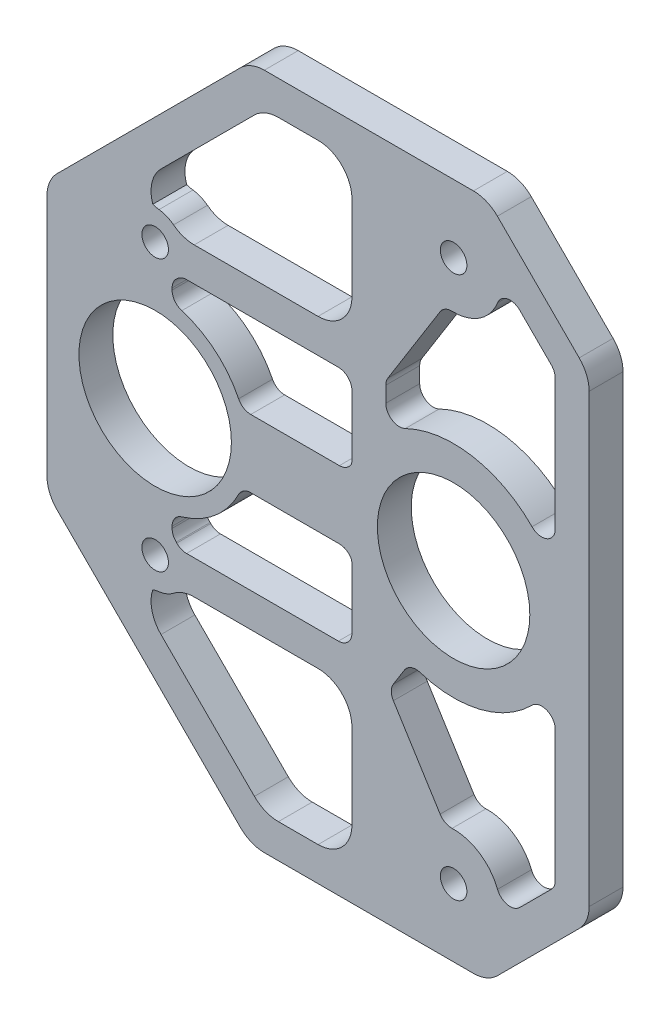
from build123d import *

# Parameters (mm, degrees)
SKETCH1_W           = 101.6
SKETCH1_H           = 127
SKETCH1_R           = 2.4892
SKETCH1_R_2         = 14.2875
BOSS_EXTRUDE1_DEPTH = 3.175
CHAMFER2_SIZE       = 38.1
CHAMFER3_SIZE       = 19.05
FILLET2_R           = 6.35
CUT_EXTRUDE2_DEPTH  = 163.763271348
FILLET11_R          = 2.54
FILLET12_R          = 6.35


with BuildPart() as part:
    # Sketch1 → Boss-Extrude1 (new, symmetric)
    with BuildSketch(Plane.XY):
        with Locations((50.8, 63.5)):
            Rectangle(SKETCH1_W, SKETCH1_H)
        with Locations((20.2692, 88.9)):
            Circle(SKETCH1_R, mode=Mode.SUBTRACT)
        with Locations((20.2692, 63.5)):
            Circle(SKETCH1_R_2, mode=Mode.SUBTRACT)
        with Locations((20.2692, 38.1)):
            Circle(SKETCH1_R, mode=Mode.SUBTRACT)
        with Locations((76.2, 114.3)):
            Circle(SKETCH1_R, mode=Mode.SUBTRACT)
        with Locations((76.2, 63.5)):
            Circle(SKETCH1_R_2, mode=Mode.SUBTRACT)
        with Locations((76.2, 12.7)):
            Circle(SKETCH1_R, mode=Mode.SUBTRACT)
    extrude(amount=BOSS_EXTRUDE1_DEPTH, both=True)

    # Chamfer2
    chamfer2_edges = [part.edges().sort_by_distance(p)[0] for p in [
        (0, 127, 0),
        (0, 0, 0),
    ]]
    chamfer(chamfer2_edges, length=CHAMFER2_SIZE)

    # Chamfer3
    chamfer3_edges = [part.edges().sort_by_distance(p)[0] for p in [
        (101.6, 127, 0),
        (101.6, 0, 0),
    ]]
    chamfer(chamfer3_edges, length=CHAMFER3_SIZE)

    # Fillet2
    fillet2_edges = [part.edges().sort_by_distance(p)[0] for p in [
        (38.1, 0, 0),
        (0, 88.9, 0),
        (0, 38.1, 0),
        (38.1, 127, 0),
        (101.6, 107.95, 0),
        (101.6, 19.05, 0),
        (82.55, 0, 0),
        (82.55, 127, 0),
    ]]
    fillet(fillet2_edges, radius=FILLET2_R)

    # Sketch2 → Cut-Extrude2 (cut, through all)
    with BuildSketch(Plane.XY.offset(3.175)):
        with BuildLine():
            Line((23.4442, 84.209313841), (23.4442, 80.671437949))
            ThreePointArc((23.4442, 80.671437949), (31.394578854, 76.959749314), (36.536234341, 69.85))
            Line((36.536234341, 69.85), (56.563709458, 69.85))
            ThreePointArc((56.563709458, 69.85), (56.840575731, 70.649762109), (57.15, 71.4375))
            Line((57.15, 71.4375), (57.15, 85.725))
            Line((57.15, 85.725), (24.959886159, 85.725))
            ThreePointArc((24.959886159, 85.725), (24.27439423, 84.89480577), (23.4442, 84.209313841))
        make_face()
        with BuildLine():
            Line((56.563709458, 57.15), (36.536234341, 57.15))
            ThreePointArc((36.536234341, 57.15), (31.394578854, 50.040250686), (23.4442, 46.328562051))
            Line((23.4442, 46.328562051), (23.4442, 42.790686159))
            ThreePointArc((23.4442, 42.790686159), (24.27439423, 42.10519423), (24.959886159, 41.275))
            Line((24.959886159, 41.275), (57.15, 41.275))
            Line((57.15, 41.275), (57.15, 55.5625))
            ThreePointArc((57.15, 55.5625), (56.840575731, 56.350237891), (56.563709458, 57.15))
        make_face()
        with BuildLine():
            Line((63.5, 87.989421981), (63.5, 79.767034341))
            ThreePointArc((63.5, 79.767034341), (81.436975328, 83.461976246), (95.25, 71.4375))
            Line((95.25, 71.4375), (95.25, 105.319743879))
            Line((95.25, 105.319743879), (84.938355823, 115.631388056))
            ThreePointArc((84.938355823, 115.631388056), (82.324026952, 107.926009842), (74.520278177, 105.621867065))
            Line((74.520278177, 105.621867065), (63.5, 87.989421981))
        make_face()
        with BuildLine():
            Line((16.869792091, 96.78953597), (19.197448039, 94.461880022))
            ThreePointArc((19.197448039, 94.461880022), (22.436795498, 94.133038448), (24.959886159, 92.075))
            Line((24.959886159, 92.075), (57.15, 92.075))
            Line((57.15, 92.075), (57.15, 120.65))
            Line((57.15, 120.65), (40.730256121, 120.65))
            Line((40.730256121, 120.65), (16.869792091, 96.78953597))
        make_face()
        with BuildLine():
            Line((57.15, 6.35), (57.15, 34.925))
            Line((57.15, 34.925), (24.959886159, 34.925))
            ThreePointArc((24.959886159, 34.925), (22.436795498, 32.866961552), (19.197448039, 32.538119978))
            Line((19.197448039, 32.538119978), (16.869792091, 30.21046403))
            Line((16.869792091, 30.21046403), (40.730256121, 6.35))
            Line((40.730256121, 6.35), (57.15, 6.35))
        make_face()
        with BuildLine():
            ThreePointArc((95.25, 55.5625), (83.968438742, 44.380435001), (68.08475867, 44.525035852))
            Line((68.08475867, 44.525035852), (64.069111262, 38.1))
            Line((64.069111262, 38.1), (74.520278177, 21.378132935))
            ThreePointArc((74.520278177, 21.378132935), (82.324026952, 19.073990158), (84.938355823, 11.368611944))
            Line((84.938355823, 11.368611944), (95.25, 21.680256121))
            Line((95.25, 21.680256121), (95.25, 55.5625))
        make_face()
    extrude(amount=-CUT_EXTRUDE2_DEPTH, mode=Mode.SUBTRACT)

    # Fillet11
    # the kernel refuses this fillet: 2.54 mm, written as the material it adds along each edge
    with BuildSketch(Plane(origin=(23.4442, 84.209313841, 3.175), x_dir=(0, -1, 0), z_dir=(0, 0, -1))) as fillet11_piece_1:
        with BuildLine():
            CenterArc((1.19554121, -2.54), FILLET11_R, 90, 45.845590986)
            ThreePointArc((-0.626820204, -0.770650155), (-0.296483035, -0.399092969), (0, 0))
            Line((0, 0), (1.19554121, 0))
        make_face()
    extrude(amount=6.35)
    with BuildSketch(Plane(origin=(24.959886159, 85.725, 3.175), x_dir=(1, 0, 0), z_dir=(0, 0, -1)), Plane(origin=(23.4442, 42.790686159, 3.175), x_dir=(0, 1, 0), z_dir=(0, 0, -1))) as fillet11_piece_2:
        with BuildLine():
            CenterArc((1.19554121, 2.54), FILLET11_R, 224.154409014, 45.845590986)
            ThreePointArc((-0.626820204, 0.770650155), (-0.296483035, 0.399092969), (0, 0))
            Line((0, 0), (1.19554121, 0))
        make_face()
    extrude(amount=6.35)
    with BuildSketch(Plane(origin=(57.15, 85.725, 3.175), x_dir=(0, -1, 0), z_dir=(0, 0, -1)), Plane(origin=(57.15, 41.275, 3.175), x_dir=(-1, 0, 0), z_dir=(0, 0, -1))) as fillet11_piece_3:
        with BuildLine():
            CenterArc((FILLET11_R, FILLET11_R), FILLET11_R, 180, 90)
            Line((0, FILLET11_R), (0, 0))
            Line((0, 0), (FILLET11_R, 0))
        make_face()
    extrude(amount=6.35)
    with BuildSketch(Plane(origin=(57.15, 71.4375, 3.175), x_dir=(-0.37419332307187475, -0.927350719506071, 0), z_dir=(0, 0, -1))) as fillet11_piece_4:
        with BuildLine():
            CenterArc((0.493537959, 2.539838856), FILLET11_R, 248.025535945, 21.329063163)
            Line((-0.456913081, 0.184368029), (0, 0))
            ThreePointArc((0, 0), (0.232463532, 0.001309292), (0.464927063, 0))
        make_face()
    extrude(amount=6.35)
    with BuildSketch(Plane(origin=(56.563709458, 69.85, 3.175), x_dir=(-1, 0, 0), z_dir=(0, 0, -1))) as fillet11_piece_5:
        with BuildLine():
            CenterArc((1.768484772, 2.54), FILLET11_R, 202.554474341, 67.445525659)
            ThreePointArc((-0.577244029, 1.565753425), (-0.27278948, 0.78871367), (0, 0))
            Line((0, 0), (1.768484772, 0))
        make_face()
    extrude(amount=6.35)
    with BuildSketch(Plane(origin=(36.536234341, 69.85, 3.175), x_dir=(-0.40443527026197257, 0.9145666253303393, 0), z_dir=(0, 0, -1))) as fillet11_piece_6:
        with BuildLine():
            CenterArc((1.655141716, 2.537520097), FILLET11_R, 203.855743112, 63.612200039)
            Line((-0.667857512, 1.510254511), (0, 0))
            ThreePointArc((0, 0), (0.771464359, 0.017049332), (1.542928718, 0))
        make_face()
    extrude(amount=6.35)
    with BuildSketch(Plane(origin=(23.4442, 80.671437949, 3.175), x_dir=(0, 1, 0), z_dir=(0, 0, -1))) as fillet11_piece_7:
        with BuildLine():
            CenterArc((1.997254788, 2.54), FILLET11_R, 196.601549599, 73.398450401)
            ThreePointArc((-0.436864925, 1.814285714), (-0.194179537, 0.91298276), (0, 0))
            Line((0, 0), (1.997254788, 0))
        make_face()
    extrude(amount=6.35)
    with BuildSketch(Plane(origin=(24.959886159, 41.275, 3.175), x_dir=(-0.6309969578574762, 0.7757853048199679, 0), z_dir=(0, 0, -1))) as fillet11_piece_8:
        with BuildLine():
            CenterArc((1.216111808, 2.530215575), FILLET11_R, 219.123714638, 45.845590986)
            Line((-0.754382867, 0.927483302), (0, 0))
            ThreePointArc((0, 0), (0.496690354, 0.021819267), (0.993380707, 0))
        make_face()
    extrude(amount=6.35)
    with BuildSketch(Plane(origin=(23.4442, 46.328562051, 3.175), x_dir=(0.9722123643495174, 0.23410065913175288, 0), z_dir=(0, 0, -1))) as fillet11_piece_9:
        with BuildLine():
            CenterArc((2.001860743, 2.536371474), FILLET11_R, 193.538615648, 73.398450401)
            Line((-0.467558662, 1.941755799), (0, 0))
            ThreePointArc((0, 0), (0.933070685, 0.024946119), (1.866141371, 0))
        make_face()
    extrude(amount=6.35)
    with BuildSketch(Plane(origin=(36.536234341, 57.15, 3.175), x_dir=(1, 0, 0), z_dir=(0, 0, -1))) as fillet11_piece_10:
        with BuildLine():
            CenterArc((1.651333505, 2.54), FILLET11_R, 206.387799961, 63.612200039)
            ThreePointArc((-0.624014793, 1.411111111), (-0.296414646, 0.712450907), (0, 0))
            Line((0, 0), (1.651333505, 0))
        make_face()
    extrude(amount=6.35)
    with BuildSketch(Plane(origin=(56.563709458, 57.15, 3.175), x_dir=(-1, 0, 0), z_dir=(0, 0, -1))) as fillet11_piece_11:
        with BuildLine():
            CenterArc((1.768484772, -2.54), FILLET11_R, 90, 67.445525659)
            ThreePointArc((-0.577244029, -1.565753425), (-0.27278948, -0.78871367), (0, 0))
            Line((0, 0), (1.768484772, 0))
        make_face()
    extrude(amount=6.35)
    with BuildSketch(Plane(origin=(57.15, 55.5625, 3.175), x_dir=(0, -1, 0), z_dir=(0, 0, -1))) as fillet11_piece_12:
        with BuildLine():
            CenterArc((0.49270796, 2.54), FILLET11_R, 248.670936837, 21.329063163)
            ThreePointArc((-0.431150447, 0.173972603), (-0.215085295, 0.088200474), (0, 0))
            Line((0, 0), (0.49270796, 0))
        make_face()
    extrude(amount=6.35)
    with BuildSketch(Plane(origin=(74.520278177, 105.621867065, 3.175), x_dir=(-0.5299989400031567, -0.8479983040051026, 0), z_dir=(0, 0, -1))) as fillet11_piece_13:
        with BuildLine():
            CenterArc((1.590675071, -2.54), FILLET11_R, 90, 59.85221241)
            ThreePointArc((-0.605746328, -1.264330357), (-0.27776736, -0.644193482), (0, 0))
            Line((0, 0), (1.590675071, 0))
        make_face()
    extrude(amount=6.35)
    with BuildSketch(Plane(origin=(84.938355823, 115.631388056, 3.175), x_dir=(0.707106781186531, -0.7071067811865639, 0), z_dir=(0, 0, -1))) as fillet11_piece_14:
        with BuildLine():
            CenterArc((5.17911732, 2.54), FILLET11_R, 156.26403204, 113.73596796)
            ThreePointArc((2.853975701, 3.562407183), (1.660911159, 1.593799007), (0, 0))
            Line((0, 0), (5.17911732, 0))
        make_face()
    extrude(amount=6.35)
    with BuildSketch(Plane(origin=(95.25, 105.319743879, 3.175), x_dir=(0, -1, 0), z_dir=(0, 0, -1)), Plane(origin=(95.25, 21.680256121, 3.175), x_dir=(-0.7071067811865459, -0.7071067811865492, 0), z_dir=(0, 0, -1))) as fillet11_piece_15:
        with BuildLine():
            CenterArc((FILLET11_R * 0.414213562373, FILLET11_R), FILLET11_R, 225, 45)
            Line((-FILLET11_R * 0.292893218813, FILLET11_R * 0.292893218813), (0, 0))
            Line((0, 0), (FILLET11_R * 0.414213562373, 0))
        make_face()
    extrude(amount=6.35)
    with BuildSketch(Plane(origin=(95.25, 71.4375, 3.175), x_dir=(-0.5533563502318898, 0.8329446258053667, 0), z_dir=(0, 0, -1))) as fillet11_piece_16:
        with BuildLine():
            CenterArc((8.343565994, 2.493521372), FILLET11_R, 123.597578731, 135.424707486)
            Line((6.938040865, 4.609200722), (0, 0))
            ThreePointArc((0, 0), (3.929940505, 0.377638848), (7.859881009, 0))
        make_face()
    extrude(amount=6.35)
    with BuildSketch(Plane(origin=(63.5, 79.767034341, 3.175), x_dir=(0, 1, 0), z_dir=(0, 0, -1))) as fillet11_piece_17:
        with BuildLine():
            CenterArc((4.564934031, 2.54), FILLET11_R, 154.000955085, 115.999044915)
            ThreePointArc((2.281978593, 3.653424658), (1.236569999, 1.767011326), (0, 0))
            Line((0, 0), (4.564934031, 0))
        make_face()
    extrude(amount=6.35)
    with BuildSketch(Plane(origin=(63.5, 87.989421981, 3.175), x_dir=(0.5299989400031537, 0.8479983040051045, 0), z_dir=(0, 0, -1))) as fillet11_piece_18:
        with BuildLine():
            CenterArc((FILLET11_R * 0.286796226411, FILLET11_R), FILLET11_R, 237.994616792, 32.005383208)
            Line((-FILLET11_R * 0.243202713592, FILLET11_R * 0.152001695995), (0, 0))
            Line((0, 0), (FILLET11_R * 0.286796226411, 0))
        make_face()
    extrude(amount=6.35)
    with BuildSketch(Plane(origin=(84.938355823, 11.368611944, 3.175), x_dir=(-0.10974291485412428, 0.9939600055532016, 0), z_dir=(0, 0, -1))) as fillet11_piece_19:
        with BuildLine():
            CenterArc((5.220477065, 2.453869482), FILLET11_R, 141.300495955, 113.73596796)
            Line((3.238170083, 4.04196867), (0, 0))
            ThreePointArc((0, 0), (2.282319119, 0.299734204), (4.564638238, 0))
        make_face()
    extrude(amount=6.35)
    with BuildSketch(Plane(origin=(74.520278177, 21.378132935, 3.175), x_dir=(-0.5299989400031518, 0.8479983040051056, 0), z_dir=(0, 0, -1))) as fillet11_piece_20:
        with BuildLine():
            CenterArc((1.590675071, 2.54), FILLET11_R, 210.14778759, 59.85221241)
            ThreePointArc((-0.605746328, 1.264330357), (-0.27776736, 0.644193482), (0, 0))
            Line((0, 0), (1.590675071, 0))
        make_face()
    extrude(amount=6.35)
    with BuildSketch(Plane(origin=(64.069111262, 38.1, 3.175), x_dir=(0.5299989400031772, 0.8479983040050897, 0), z_dir=(0, 0, -1))) as fillet11_piece_21:
        with BuildLine():
            CenterArc((FILLET11_R * 0.625, FILLET11_R), FILLET11_R, 205.989233584, 64.010766416)
            Line((-FILLET11_R * 0.273876404494, FILLET11_R * 0.561797752809), (0, 0))
            Line((0, 0), (FILLET11_R * 0.625, 0))
        make_face()
    extrude(amount=6.35)
    with BuildSketch(Plane(origin=(68.08475867, 44.525035852, 3.175), x_dir=(-0.5299989400032423, -0.8479983040050492, 0), z_dir=(0, 0, -1))) as fillet11_piece_22:
        with BuildLine():
            CenterArc((2.070056099, -2.54), FILLET11_R, 90, 75.7250493)
            ThreePointArc((-0.391517908, -1.91369863), (-0.173104834, -0.961484054), (0, 0))
            Line((0, 0), (2.070056099, 0))
        make_face()
    extrude(amount=6.35)
    with BuildSketch(Plane(origin=(95.25, 55.5625, 3.175), x_dir=(0, -1, 0), z_dir=(0, 0, -1))) as fillet11_piece_23:
        with BuildLine():
            CenterArc((8.329534341, 2.54), FILLET11_R, 134.575292514, 135.424707486)
            ThreePointArc((6.546845646, 4.349315068), (3.482391678, 1.860105285), (0, 0))
            Line((0, 0), (8.329534341, 0))
        make_face()
    extrude(amount=6.35)

    # Fillet12
    # the kernel refuses this fillet: 6.35 mm, written as the material it adds along each edge
    with BuildSketch(Plane(origin=(57.15, 34.925, 3.175), x_dir=(-1, 0, 0), z_dir=(0, 0, -1)), Plane(origin=(57.15, 6.35, 3.175), x_dir=(0, 1, 0), z_dir=(0, 0, -1)), Plane(origin=(16.869792091, 96.78953597, 3.175), x_dir=(0.7071067811865476, -0.7071067811865476, 0), z_dir=(0, 0, -1)), Plane(origin=(57.15, 120.65, 3.175), x_dir=(-1, 0, 0), z_dir=(0, 0, -1)), Plane(origin=(57.15, 92.075, 3.175), x_dir=(0, 1, 0), z_dir=(0, 0, -1))) as fillet12_piece_1:
        with BuildLine():
            CenterArc((FILLET12_R, -FILLET12_R), FILLET12_R, 90, 90)
            Line((0, -FILLET12_R), (0, 0))
            Line((0, 0), (FILLET12_R, 0))
        make_face()
    extrude(amount=6.35)
    with BuildSketch(Plane(origin=(16.869792091, 30.21046403, 3.175), x_dir=(0.7071067811865469, 0.707106781186548, 0), z_dir=(0, 0, -1))) as fillet12_piece_2:
        with BuildLine():
            CenterArc((FILLET12_R, FILLET12_R), FILLET12_R, 180, 90)
            Line((0, FILLET12_R), (0, 0))
            Line((0, 0), (FILLET12_R, 0))
        make_face()
    extrude(amount=6.35)
    with BuildSketch(Plane(origin=(19.197448039, 32.538119978, 3.175), x_dir=(-0.7071067811865529, -0.7071067811865421, 0), z_dir=(0, 0, -1))) as fillet12_piece_3:
        with BuildLine():
            CenterArc((2.631565998, -6.35), FILLET12_R, 90, 37.550935819)
            ThreePointArc((-1.238546136, -1.31564482), (-0.566472915, -0.707528398), (0, 0))
            Line((0, 0), (2.631565998, 0))
        make_face()
    extrude(amount=6.35)
    with BuildSketch(Plane(origin=(24.959886159, 34.925, 3.175), x_dir=(-0.6854504427601381, -0.7281192831672093, 0), z_dir=(0, 0, -1)), Plane(origin=(19.197448039, 94.461880022, 3.175), x_dir=(0.999544738883237, 0.030171426397194983, 0), z_dir=(0, 0, -1))) as fillet12_piece_4:
        with BuildLine():
            CenterArc((2.81974937, -6.268704259), FILLET12_R, 99.178021959, 37.550935819)
            Line((-1.803808078, -1.916093948), (0, 0))
            ThreePointArc((0, 0), (0.90345418, -0.072515801), (1.806908361, 0))
        make_face()
    extrude(amount=6.35)
    with BuildSketch(Plane(origin=(40.730256121, 6.35, 3.175), x_dir=(1, 0, 0), z_dir=(0, 0, -1)), Plane(origin=(40.730256121, 120.65, 3.175), x_dir=(-0.7071067811865489, -0.7071067811865462, 0), z_dir=(0, 0, -1))) as fillet12_piece_5:
        with BuildLine():
            CenterArc((FILLET12_R * 0.414213562373, -FILLET12_R), FILLET12_R, 90, 45)
            Line((-FILLET12_R * 0.292893218813, -FILLET12_R * 0.292893218813), (0, 0))
            Line((0, 0), (FILLET12_R * 0.414213562373, 0))
        make_face()
    extrude(amount=6.35)
    with BuildSketch(Plane(origin=(24.959886159, 92.075, 3.175), x_dir=(-0.6854504427601431, 0.7281192831672045, 0), z_dir=(0, 0, -1))) as fillet12_piece_6:
        with BuildLine():
            CenterArc((2.81974937, 6.268704259), FILLET12_R, 223.271042222, 37.550935819)
            Line((-1.803808078, 1.916093948), (0, 0))
            ThreePointArc((0, 0), (0.90345418, 0.072515801), (1.806908361, 0))
        make_face()
    extrude(amount=6.35)


solid = part.part
